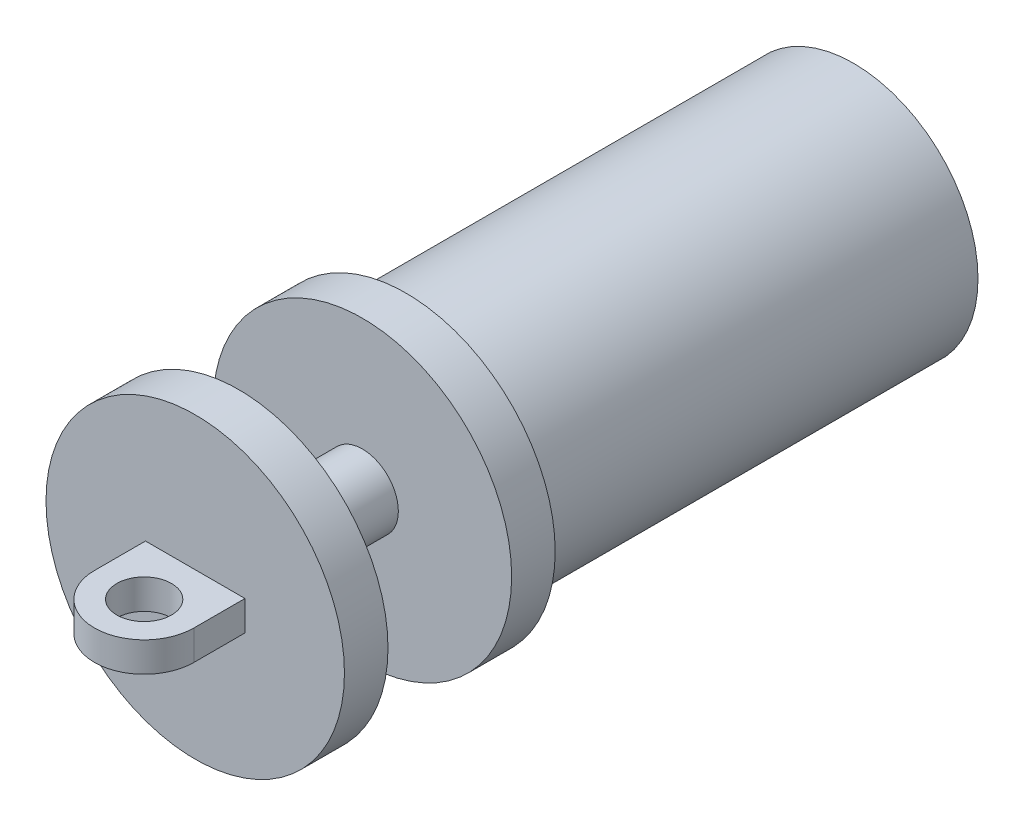
from build123d import *

# Parameters (mm, degrees)
SKETCH4_R           = 2.75
BOSS_EXTRUDE1_DEPTH = 1.5
SKETCH5_R           = 12.5
BOSS_EXTRUDE2_DEPTH = 45


with BuildPart() as part:
    # Sketch3 → Revolve2 (revolve)
    with BuildSketch(Plane(origin=(0, 0, 0), x_dir=(0, 0, -1), z_dir=(1, 0, 0))):
        Polygon((-6.214618974, 3.611197512), (6.214618974, 3.611197512), (6.214618974, 15), (10.590979782, 15), (10.590979782, 0), (-10.590979782, 0), (-10.590979782, 15), (-6.214618974, 15), align=None)
    revolve(axis=Axis((0, 0, 10.590979782), (0, 0, -1)))

    # Sketch4 → Boss-Extrude1 (add, symmetric)
    with BuildSketch(Plane(origin=(0, 0, 0), x_dir=(1, 0, 0), z_dir=(0, 1, 0))):
        with BuildLine():
            Line((-5, -15.723809824), (-5, -10.590979782))
            Line((-5, -10.590979782), (5, -10.590979782))
            Line((5, -10.590979782), (5, -15.723809824))
            ThreePointArc((5, -15.723809824), (0, -20.723809824), (-5, -15.723809824))
        make_face()
        with Locations((0, -15.723809824)):
            Circle(SKETCH4_R, mode=Mode.SUBTRACT)
    extrude(amount=BOSS_EXTRUDE1_DEPTH, both=True)

    # Sketch5 → Boss-Extrude2 (add)
    with BuildSketch(Plane(origin=(0, 0, -10.590979782), x_dir=(-1, 0, 0), z_dir=(0, 0, -1))):
        Circle(SKETCH5_R)
    extrude(amount=BOSS_EXTRUDE2_DEPTH)


solid = part.part
